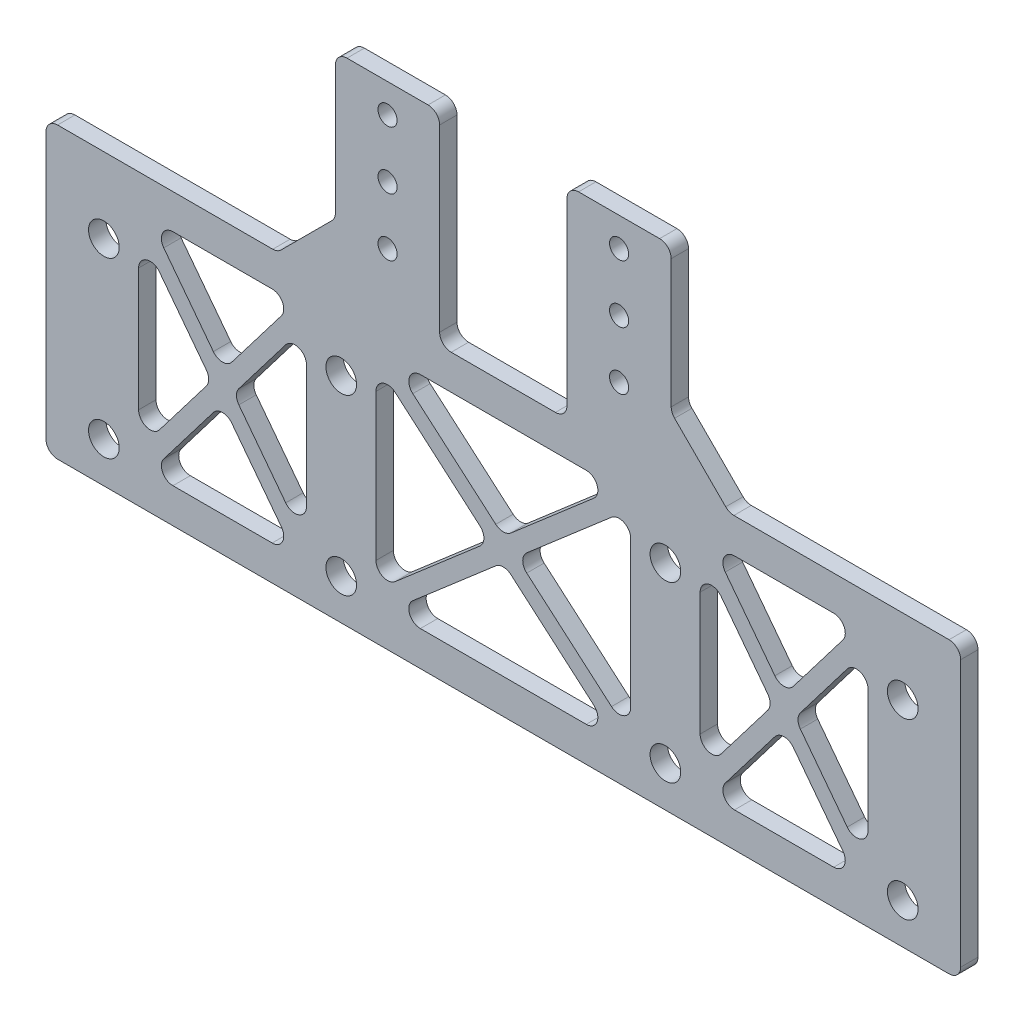
from build123d import *

# Parameters (mm, degrees)
SKETCH_1_R          = 1.55
SKETCH_1_R_2        = 2.65
SKETCH_1_W          = 29
SKETCH_1_H          = 38
SKETCH_1_W_2        = 44
EXTRUDE_1_DEPTH     = 3
SKETCH_4_W          = 20
SKETCH_4_H          = 35
CUT_EXTRUDE_1_DEPTH = 10
SKETCH_3_W          = 18
SKETCH_3_H          = 35
EXTRUDE_2_DEPTH     = 3
SKETCH_5_R          = 1.65
CUT_EXTRUDE_2_DEPTH = 5
CHAMFER_1_SIZE      = 10
FILLET_1_R          = 2
EXTRUDE_1_2_DEPTH   = 3
FILLET_3_R          = 2


with BuildPart() as part:
    # 草图1 → Extrude 1 (new body)
    with BuildSketch(Plane.XY):
        Polygon((-10, 50), (-10, 85), (10, 85), (10, 50), (79, 50), (79, 0), (-79, 0), (-79, 50), align=None)
        with Locations((-6, 81)):
            Circle(SKETCH_1_R, mode=Mode.SUBTRACT)
        with Locations((6, 81)):
            Circle(SKETCH_1_R, mode=Mode.SUBTRACT)
        with Locations((-6, 59)):
            Circle(SKETCH_1_R, mode=Mode.SUBTRACT)
        with Locations((6, 59)):
            Circle(SKETCH_1_R, mode=Mode.SUBTRACT)
        with Locations((-69, 37)):
            Circle(SKETCH_1_R_2, mode=Mode.SUBTRACT)
        with Locations((-69, 7)):
            Circle(SKETCH_1_R_2, mode=Mode.SUBTRACT)
        with Locations((69, 7)):
            Circle(SKETCH_1_R_2, mode=Mode.SUBTRACT)
        with Locations((69, 37)):
            Circle(SKETCH_1_R_2, mode=Mode.SUBTRACT)
        with Locations((-28, 37)):
            Circle(SKETCH_1_R_2, mode=Mode.SUBTRACT)
        with Locations((-28, 7)):
            Circle(SKETCH_1_R_2, mode=Mode.SUBTRACT)
        with Locations((28, 7)):
            Circle(SKETCH_1_R_2, mode=Mode.SUBTRACT)
        with Locations((28, 37)):
            Circle(SKETCH_1_R_2, mode=Mode.SUBTRACT)
        with Locations((-48.5, 25)):
            Rectangle(SKETCH_1_W, SKETCH_1_H, mode=Mode.SUBTRACT)
        with Locations((48.5, 25)):
            Rectangle(SKETCH_1_W, SKETCH_1_H, mode=Mode.SUBTRACT)
        with Locations((0, 25)):
            Rectangle(SKETCH_1_W_2, SKETCH_1_H, mode=Mode.SUBTRACT)
    extrude(amount=EXTRUDE_1_DEPTH)

    # 草图4 → 切除-拉伸1 (cut)
    with BuildSketch(Plane(origin=(0, 0, 0), x_dir=(-1, 0, 0), z_dir=(0, 0, -1))):
        with Locations((0, 67.5)):
            Rectangle(SKETCH_4_W, SKETCH_4_H)
    extrude(amount=-CUT_EXTRUDE_1_DEPTH, mode=Mode.SUBTRACT)

    # 草图3 → 凸台-拉伸2 (add)
    with BuildSketch(Plane(origin=(0, 0, 0), x_dir=(-1, 0, 0), z_dir=(0, 0, -1))):
        with Locations((-20, 67.5)):
            Rectangle(SKETCH_3_W, SKETCH_3_H)
        with Locations((20, 67.5)):
            Rectangle(SKETCH_3_W, SKETCH_3_H)
    extrude(amount=-EXTRUDE_2_DEPTH)

    # 草图5 → 切除-拉伸2 (cut)
    with BuildSketch(Plane(origin=(0, 0, 0), x_dir=(-1, 0, 0), z_dir=(0, 0, -1))):
        with Locations((-20, 80)):
            Circle(SKETCH_5_R)
        with Locations((-20, 70)):
            Circle(SKETCH_5_R)
        with Locations((-20, 60)):
            Circle(SKETCH_5_R)
        with Locations((20, 60)):
            Circle(SKETCH_5_R)
        with Locations((20, 70)):
            Circle(SKETCH_5_R)
        with Locations((20, 80)):
            Circle(SKETCH_5_R)
    extrude(amount=-CUT_EXTRUDE_2_DEPTH, mode=Mode.SUBTRACT)

    # 倒角1
    chamfer_1_edges = [part.edges().sort_by_distance(p)[0] for p in [
        (-29, 50, 1.5),
        (29, 50, 1.5),
    ]]
    chamfer(chamfer_1_edges, length=CHAMFER_1_SIZE)

    # 圆角1
    fillet_1_edges = [part.edges().sort_by_distance(p)[0] for p in [
        (79, 0, 1.5),
        (-79, 0, 1.5),
        (-79, 50, 1.5),
        (-39, 50, 1.5),
        (-29, 60, 1.5),
        (-29, 85, 1.5),
        (-11, 85, 1.5),
        (-11, 50, 1.5),
        (11, 50, 1.5),
        (11, 85, 1.5),
        (29, 85, 1.5),
        (39, 50, 1.5),
        (79, 50, 1.5),
        (29, 60, 1.5),
    ]]
    fillet(fillet_1_edges, radius=FILLET_1_R)

    # 草图6 → Extrude 1 2 (add)
    with BuildSketch(Plane(origin=(0, 0, 0), x_dir=(-1, 0, 0), z_dir=(0, 0, -1))):
        Polygon((-64.192426869, 43.089990021), (-35.192426869, 5.089990021), (-32.807573131, 6.910009979), (-61.807573131, 44.910009979), align=None)
        Polygon((-35.192426869, 44.910009979), (-64.192426869, 6.910009979), (-61.807573131, 5.089990021), (-32.807573131, 43.089990021), align=None)
        Polygon((-22.980429806, 42.864765488), (21.019570194, 4.864765488), (22.980429806, 7.135234512), (-21.019570194, 45.135234512), align=None)
        Polygon((21.019570194, 45.135234512), (-22.980429806, 7.135234512), (-21.019570194, 4.864765488), (22.980429806, 42.864765488), align=None)
        Polygon((32.807573131, 43.089990021), (61.807573131, 5.089990021), (64.192426869, 6.910009979), (35.192426869, 44.910009979), align=None)
        Polygon((61.807573131, 44.910009979), (32.807573131, 6.910009979), (35.192426869, 5.089990021), (64.192426869, 43.089990021), align=None)
    extrude(amount=-EXTRUDE_1_2_DEPTH)

    # 圆角3
    fillet_3_edges = [part.edges().sort_by_distance(p)[0] for p in [
        (0, 23.018030656, 1.5),
        (19.705088128, 6, 1.5),
        (-19.705088128, 6, 1.5),
        (-22, 42.018030656, 1.5),
        (-2.294911872, 25, 1.5),
        (-22, 7.981969344, 1.5),
        (22, 7.981969344, 1.5),
        (2.294911872, 25, 1.5),
        (22, 42.018030656, 1.5),
        (0, 26.981969344, 1.5),
        (-19.705088128, 44, 1.5),
        (19.705088128, 44, 1.5),
        (48.5, 27.472500359, 1.5),
        (35.886908169, 44, 1.5),
        (61.113091831, 44, 1.5),
        (63, 8.472500359, 1.5),
        (50.386908169, 25, 1.5),
        (34, 41.527499641, 1.5),
        (46.613091831, 25, 1.5),
        (34, 8.472500359, 1.5),
        (48.5, 22.527499641, 1.5),
        (61.113091831, 6, 1.5),
        (35.886908169, 6, 1.5),
        (-48.5, 27.472500359, 1.5),
        (-61.113091831, 44, 1.5),
        (-35.886908169, 44, 1.5),
        (-34, 8.472500359, 1.5),
        (-46.613091831, 25, 1.5),
        (-34, 41.527499641, 1.5),
        (-63, 41.527499641, 1.5),
        (-50.386908169, 25, 1.5),
        (-63, 8.472500359, 1.5),
        (-48.5, 22.527499641, 1.5),
        (-35.886908169, 6, 1.5),
        (-61.113091831, 6, 1.5),
        (63, 41.527499641, 1.5),
    ]]
    fillet(fillet_3_edges, radius=FILLET_3_R)


solid = part.part
